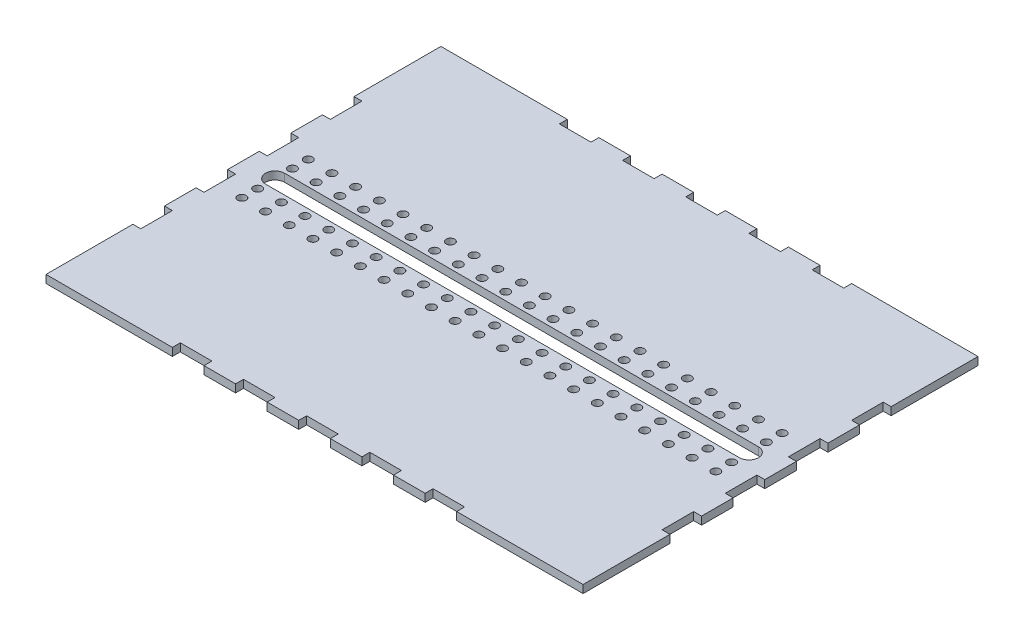
from build123d import *

# Parameters (mm, degrees)
BOSS_EXTRUDE1_DEPTH      = 1.5875
CUT_EXTRUDE1_DEPTH       = 152.481733807
SKETCH3_R                = 1.7018
CUT_EXTRUDE2_DEPTH       = 152.481733807
LPATTERN1_COUNT          = 21
LPATTERN1_PITCH          = 9.525
MIRROR1_COPY_1_SKETCH_R  = 1.7018
MIRROR1_COPY_1_DEPTH     = 152.481733807
MIRROR1_COPY_2_SKETCH_R  = 1.7018
MIRROR1_COPY_2_DEPTH     = 152.481733807
MIRROR1_COPY_3_SKETCH_R  = 1.7018
MIRROR1_COPY_3_DEPTH     = 152.481733807
MIRROR1_COPY_4_SKETCH_R  = 1.7018
MIRROR1_COPY_4_DEPTH     = 152.481733807
MIRROR1_COPY_5_SKETCH_R  = 1.7018
MIRROR1_COPY_5_DEPTH     = 152.481733807
MIRROR1_COPY_6_SKETCH_R  = 1.7018
MIRROR1_COPY_6_DEPTH     = 152.481733807
MIRROR1_COPY_7_SKETCH_R  = 1.7018
MIRROR1_COPY_7_DEPTH     = 152.481733807
MIRROR1_COPY_8_SKETCH_R  = 1.7018
MIRROR1_COPY_8_DEPTH     = 152.481733807
MIRROR1_COPY_9_SKETCH_R  = 1.7018
MIRROR1_COPY_9_DEPTH     = 152.481733807
MIRROR1_COPY_10_SKETCH_R = 1.7018
MIRROR1_COPY_10_DEPTH    = 152.481733807
MIRROR1_COPY_11_SKETCH_R = 1.7018
MIRROR1_COPY_11_DEPTH    = 152.481733807
MIRROR1_COPY_12_SKETCH_R = 1.7018
MIRROR1_COPY_12_DEPTH    = 152.481733807
MIRROR1_COPY_13_SKETCH_R = 1.7018
MIRROR1_COPY_13_DEPTH    = 152.481733807
MIRROR1_COPY_14_SKETCH_R = 1.7018
MIRROR1_COPY_14_DEPTH    = 152.481733807
MIRROR1_COPY_15_SKETCH_R = 1.7018
MIRROR1_COPY_15_DEPTH    = 152.481733807
MIRROR1_COPY_16_SKETCH_R = 1.7018
MIRROR1_COPY_16_DEPTH    = 152.481733807
MIRROR1_COPY_17_SKETCH_R = 1.7018
MIRROR1_COPY_17_DEPTH    = 152.481733807
MIRROR1_COPY_18_SKETCH_R = 1.7018
MIRROR1_COPY_18_DEPTH    = 152.481733807
MIRROR1_COPY_19_SKETCH_R = 1.7018
MIRROR1_COPY_19_DEPTH    = 152.481733807
MIRROR1_COPY_20_SKETCH_R = 1.7018
MIRROR1_COPY_20_DEPTH    = 152.481733807
MIRROR1_COPY_21_SKETCH_R = 1.7018
MIRROR1_COPY_21_DEPTH    = 152.481733807


with BuildPart() as part:
    # Sketch1 → Boss-Extrude1 (new, symmetric)
    with BuildSketch(Plane(origin=(0, 0, 0), x_dir=(1, 0, 0), z_dir=(0, 1, 0))):
        Polygon((-122.014602546, 89.716619519), (-71.214602546, 89.716619519), (-71.214602546, 86.541619519), (-58.514602546, 86.541619519), (-58.514602546, 89.716619519), (-45.814602546, 89.716619519), (-45.814602546, 86.541619519), (-33.114602546, 86.541619519), (-33.114602546, 89.716619519), (-20.414602546, 89.716619519), (-20.414602546, 86.541619519), (-7.714602546, 86.541619519), (-7.714602546, 89.716619519), (4.985397454, 89.716619519), (4.985397454, 86.541619519), (17.685397454, 86.541619519), (17.685397454, 89.716619519), (30.385397454, 89.716619519), (30.385397454, 86.541619519), (43.085397454, 86.541619519), (43.085397454, 89.716619519), (93.885397454, 89.716619519), (93.885397454, 54.791619519), (90.710397454, 54.791619519), (90.710397454, 42.091619519), (93.885397454, 42.091619519), (93.885397454, 29.391619519), (90.710397454, 29.391619519), (90.710397454, 16.691619519), (93.885397454, 16.691619519), (93.885397454, 3.991619519), (90.710397454, 3.991619519), (90.710397454, -8.708380481), (93.885397454, -8.708380481), (93.885397454, -21.408380481), (90.710397454, -21.408380481), (90.710397454, -34.108380481), (93.885397454, -34.108380481), (93.885397454, -69.033380481), (43.085397454, -69.033380481), (43.085397454, -65.858380481), (30.385397454, -65.858380481), (30.385397454, -69.033380481), (17.685397454, -69.033380481), (17.685397454, -65.858380481), (4.985397454, -65.858380481), (4.985397454, -69.033380481), (-7.714602546, -69.033380481), (-7.714602546, -65.858380481), (-20.414602546, -65.858380481), (-20.414602546, -69.033380481), (-33.114602546, -69.033380481), (-33.114602546, -65.858380481), (-45.814602546, -65.858380481), (-45.814602546, -69.033380481), (-58.514602546, -69.033380481), (-58.514602546, -65.858380481), (-71.214602546, -65.858380481), (-71.214602546, -69.033380481), (-122.014602546, -69.033380481), (-122.014602546, -34.108380481), (-118.839602546, -34.108380481), (-118.839602546, -21.408380481), (-122.014602546, -21.408380481), (-122.014602546, -8.708380481), (-118.839602546, -8.708380481), (-118.839602546, 3.991619519), (-122.014602546, 3.991619519), (-122.014602546, 16.691619519), (-118.839602546, 16.691619519), (-118.839602546, 29.391619519), (-122.014602546, 29.391619519), (-122.014602546, 42.091619519), (-118.839602546, 42.091619519), (-118.839602546, 54.791619519), (-122.014602546, 54.791619519), align=None)
    extrude(amount=BOSS_EXTRUDE1_DEPTH, both=True)

    # Sketch2 → Cut-Extrude1 (cut, through all)
    with BuildSketch(Plane(origin=(0, 1.5875, 0), x_dir=(1, 0, 0), z_dir=(0, 1, 0))):
        with BuildLine():
            Line((81.185397454, 6.531619519), (-109.314602546, 6.531619519))
            ThreePointArc((-109.314602546, 6.531619519), (-113.124602546, 10.341619519), (-109.314602546, 14.151619519))
            Line((-109.314602546, 14.151619519), (81.185397454, 14.151619519))
            ThreePointArc((81.185397454, 14.151619519), (84.995397454, 10.341619519), (81.185397454, 6.531619519))
        make_face()
    extrude(amount=-CUT_EXTRUDE1_DEPTH, mode=Mode.SUBTRACT)

    # Sketch3 → Cut-Extrude2 (cut, through all)
    with BuildSketch(Plane(origin=(0, 1.5875, 0), x_dir=(1, 0, 0), z_dir=(0, 1, 0))):
        with Locations((-109.314602546, 23.676619519)):
            Circle(SKETCH3_R)
        with Locations((-109.314602546, 17.326619519)):
            Circle(SKETCH3_R)
    cut_extrude2 = extrude(amount=-CUT_EXTRUDE2_DEPTH, mode=Mode.SUBTRACT)

    # LPattern1: Cut-Extrude2 ×21
    with Locations(*[(i * LPATTERN1_PITCH, 0, 0) for i in range(1, LPATTERN1_COUNT)]):
        add(cut_extrude2, mode=Mode.SUBTRACT)

    # Mirror1 copy 1 sketch → Mirror1 copy 1 (cut, through all)
    with BuildSketch(Plane(origin=(9.525, 1.5875, -20.683239038), x_dir=(1, 0, 0), z_dir=(0, 1, 0))):
        with Locations((-109.314602546, -23.676619519)):
            Circle(MIRROR1_COPY_1_SKETCH_R)
        with Locations((-109.314602546, -17.326619519)):
            Circle(MIRROR1_COPY_1_SKETCH_R)
    extrude(amount=-MIRROR1_COPY_1_DEPTH, mode=Mode.SUBTRACT)

    # Mirror1 copy 2 sketch → Mirror1 copy 2 (cut, through all)
    with BuildSketch(Plane(origin=(19.05, 1.5875, -20.683239038), x_dir=(1, 0, 0), z_dir=(0, 1, 0))):
        with Locations((-109.314602546, -23.676619519)):
            Circle(MIRROR1_COPY_2_SKETCH_R)
        with Locations((-109.314602546, -17.326619519)):
            Circle(MIRROR1_COPY_2_SKETCH_R)
    extrude(amount=-MIRROR1_COPY_2_DEPTH, mode=Mode.SUBTRACT)

    # Mirror1 copy 3 sketch → Mirror1 copy 3 (cut, through all)
    with BuildSketch(Plane(origin=(28.575, 1.5875, -20.683239038), x_dir=(1, 0, 0), z_dir=(0, 1, 0))):
        with Locations((-109.314602546, -23.676619519)):
            Circle(MIRROR1_COPY_3_SKETCH_R)
        with Locations((-109.314602546, -17.326619519)):
            Circle(MIRROR1_COPY_3_SKETCH_R)
    extrude(amount=-MIRROR1_COPY_3_DEPTH, mode=Mode.SUBTRACT)

    # Mirror1 copy 4 sketch → Mirror1 copy 4 (cut, through all)
    with BuildSketch(Plane(origin=(38.1, 1.5875, -20.683239038), x_dir=(1, 0, 0), z_dir=(0, 1, 0))):
        with Locations((-109.314602546, -23.676619519)):
            Circle(MIRROR1_COPY_4_SKETCH_R)
        with Locations((-109.314602546, -17.326619519)):
            Circle(MIRROR1_COPY_4_SKETCH_R)
    extrude(amount=-MIRROR1_COPY_4_DEPTH, mode=Mode.SUBTRACT)

    # Mirror1 copy 5 sketch → Mirror1 copy 5 (cut, through all)
    with BuildSketch(Plane(origin=(47.625, 1.5875, -20.683239038), x_dir=(1, 0, 0), z_dir=(0, 1, 0))):
        with Locations((-109.314602546, -23.676619519)):
            Circle(MIRROR1_COPY_5_SKETCH_R)
        with Locations((-109.314602546, -17.326619519)):
            Circle(MIRROR1_COPY_5_SKETCH_R)
    extrude(amount=-MIRROR1_COPY_5_DEPTH, mode=Mode.SUBTRACT)

    # Mirror1 copy 6 sketch → Mirror1 copy 6 (cut, through all)
    with BuildSketch(Plane(origin=(57.15, 1.5875, -20.683239038), x_dir=(1, 0, 0), z_dir=(0, 1, 0))):
        with Locations((-109.314602546, -23.676619519)):
            Circle(MIRROR1_COPY_6_SKETCH_R)
        with Locations((-109.314602546, -17.326619519)):
            Circle(MIRROR1_COPY_6_SKETCH_R)
    extrude(amount=-MIRROR1_COPY_6_DEPTH, mode=Mode.SUBTRACT)

    # Mirror1 copy 7 sketch → Mirror1 copy 7 (cut, through all)
    with BuildSketch(Plane(origin=(66.675, 1.5875, -20.683239038), x_dir=(1, 0, 0), z_dir=(0, 1, 0))):
        with Locations((-109.314602546, -23.676619519)):
            Circle(MIRROR1_COPY_7_SKETCH_R)
        with Locations((-109.314602546, -17.326619519)):
            Circle(MIRROR1_COPY_7_SKETCH_R)
    extrude(amount=-MIRROR1_COPY_7_DEPTH, mode=Mode.SUBTRACT)

    # Mirror1 copy 8 sketch → Mirror1 copy 8 (cut, through all)
    with BuildSketch(Plane(origin=(76.2, 1.5875, -20.683239038), x_dir=(1, 0, 0), z_dir=(0, 1, 0))):
        with Locations((-109.314602546, -23.676619519)):
            Circle(MIRROR1_COPY_8_SKETCH_R)
        with Locations((-109.314602546, -17.326619519)):
            Circle(MIRROR1_COPY_8_SKETCH_R)
    extrude(amount=-MIRROR1_COPY_8_DEPTH, mode=Mode.SUBTRACT)

    # Mirror1 copy 9 sketch → Mirror1 copy 9 (cut, through all)
    with BuildSketch(Plane(origin=(85.725, 1.5875, -20.683239038), x_dir=(1, 0, 0), z_dir=(0, 1, 0))):
        with Locations((-109.314602546, -23.676619519)):
            Circle(MIRROR1_COPY_9_SKETCH_R)
        with Locations((-109.314602546, -17.326619519)):
            Circle(MIRROR1_COPY_9_SKETCH_R)
    extrude(amount=-MIRROR1_COPY_9_DEPTH, mode=Mode.SUBTRACT)

    # Mirror1 copy 10 sketch → Mirror1 copy 10 (cut, through all)
    with BuildSketch(Plane(origin=(95.25, 1.5875, -20.683239038), x_dir=(1, 0, 0), z_dir=(0, 1, 0))):
        with Locations((-109.314602546, -23.676619519)):
            Circle(MIRROR1_COPY_10_SKETCH_R)
        with Locations((-109.314602546, -17.326619519)):
            Circle(MIRROR1_COPY_10_SKETCH_R)
    extrude(amount=-MIRROR1_COPY_10_DEPTH, mode=Mode.SUBTRACT)

    # Mirror1 copy 11 sketch → Mirror1 copy 11 (cut, through all)
    with BuildSketch(Plane(origin=(104.775, 1.5875, -20.683239038), x_dir=(1, 0, 0), z_dir=(0, 1, 0))):
        with Locations((-109.314602546, -23.676619519)):
            Circle(MIRROR1_COPY_11_SKETCH_R)
        with Locations((-109.314602546, -17.326619519)):
            Circle(MIRROR1_COPY_11_SKETCH_R)
    extrude(amount=-MIRROR1_COPY_11_DEPTH, mode=Mode.SUBTRACT)

    # Mirror1 copy 12 sketch → Mirror1 copy 12 (cut, through all)
    with BuildSketch(Plane(origin=(114.3, 1.5875, -20.683239038), x_dir=(1, 0, 0), z_dir=(0, 1, 0))):
        with Locations((-109.314602546, -23.676619519)):
            Circle(MIRROR1_COPY_12_SKETCH_R)
        with Locations((-109.314602546, -17.326619519)):
            Circle(MIRROR1_COPY_12_SKETCH_R)
    extrude(amount=-MIRROR1_COPY_12_DEPTH, mode=Mode.SUBTRACT)

    # Mirror1 copy 13 sketch → Mirror1 copy 13 (cut, through all)
    with BuildSketch(Plane(origin=(123.825, 1.5875, -20.683239038), x_dir=(1, 0, 0), z_dir=(0, 1, 0))):
        with Locations((-109.314602546, -23.676619519)):
            Circle(MIRROR1_COPY_13_SKETCH_R)
        with Locations((-109.314602546, -17.326619519)):
            Circle(MIRROR1_COPY_13_SKETCH_R)
    extrude(amount=-MIRROR1_COPY_13_DEPTH, mode=Mode.SUBTRACT)

    # Mirror1 copy 14 sketch → Mirror1 copy 14 (cut, through all)
    with BuildSketch(Plane(origin=(133.35, 1.5875, -20.683239038), x_dir=(1, 0, 0), z_dir=(0, 1, 0))):
        with Locations((-109.314602546, -23.676619519)):
            Circle(MIRROR1_COPY_14_SKETCH_R)
        with Locations((-109.314602546, -17.326619519)):
            Circle(MIRROR1_COPY_14_SKETCH_R)
    extrude(amount=-MIRROR1_COPY_14_DEPTH, mode=Mode.SUBTRACT)

    # Mirror1 copy 15 sketch → Mirror1 copy 15 (cut, through all)
    with BuildSketch(Plane(origin=(142.875, 1.5875, -20.683239038), x_dir=(1, 0, 0), z_dir=(0, 1, 0))):
        with Locations((-109.314602546, -23.676619519)):
            Circle(MIRROR1_COPY_15_SKETCH_R)
        with Locations((-109.314602546, -17.326619519)):
            Circle(MIRROR1_COPY_15_SKETCH_R)
    extrude(amount=-MIRROR1_COPY_15_DEPTH, mode=Mode.SUBTRACT)

    # Mirror1 copy 16 sketch → Mirror1 copy 16 (cut, through all)
    with BuildSketch(Plane(origin=(152.4, 1.5875, -20.683239038), x_dir=(1, 0, 0), z_dir=(0, 1, 0))):
        with Locations((-109.314602546, -23.676619519)):
            Circle(MIRROR1_COPY_16_SKETCH_R)
        with Locations((-109.314602546, -17.326619519)):
            Circle(MIRROR1_COPY_16_SKETCH_R)
    extrude(amount=-MIRROR1_COPY_16_DEPTH, mode=Mode.SUBTRACT)

    # Mirror1 copy 17 sketch → Mirror1 copy 17 (cut, through all)
    with BuildSketch(Plane(origin=(161.925, 1.5875, -20.683239038), x_dir=(1, 0, 0), z_dir=(0, 1, 0))):
        with Locations((-109.314602546, -23.676619519)):
            Circle(MIRROR1_COPY_17_SKETCH_R)
        with Locations((-109.314602546, -17.326619519)):
            Circle(MIRROR1_COPY_17_SKETCH_R)
    extrude(amount=-MIRROR1_COPY_17_DEPTH, mode=Mode.SUBTRACT)

    # Mirror1 copy 18 sketch → Mirror1 copy 18 (cut, through all)
    with BuildSketch(Plane(origin=(171.45, 1.5875, -20.683239038), x_dir=(1, 0, 0), z_dir=(0, 1, 0))):
        with Locations((-109.314602546, -23.676619519)):
            Circle(MIRROR1_COPY_18_SKETCH_R)
        with Locations((-109.314602546, -17.326619519)):
            Circle(MIRROR1_COPY_18_SKETCH_R)
    extrude(amount=-MIRROR1_COPY_18_DEPTH, mode=Mode.SUBTRACT)

    # Mirror1 copy 19 sketch → Mirror1 copy 19 (cut, through all)
    with BuildSketch(Plane(origin=(180.975, 1.5875, -20.683239038), x_dir=(1, 0, 0), z_dir=(0, 1, 0))):
        with Locations((-109.314602546, -23.676619519)):
            Circle(MIRROR1_COPY_19_SKETCH_R)
        with Locations((-109.314602546, -17.326619519)):
            Circle(MIRROR1_COPY_19_SKETCH_R)
    extrude(amount=-MIRROR1_COPY_19_DEPTH, mode=Mode.SUBTRACT)

    # Mirror1 copy 20 sketch → Mirror1 copy 20 (cut, through all)
    with BuildSketch(Plane(origin=(190.5, 1.5875, -20.683239038), x_dir=(1, 0, 0), z_dir=(0, 1, 0))):
        with Locations((-109.314602546, -23.676619519)):
            Circle(MIRROR1_COPY_20_SKETCH_R)
        with Locations((-109.314602546, -17.326619519)):
            Circle(MIRROR1_COPY_20_SKETCH_R)
    extrude(amount=-MIRROR1_COPY_20_DEPTH, mode=Mode.SUBTRACT)

    # Mirror1 copy 21 sketch → Mirror1 copy 21 (cut, through all)
    with BuildSketch(Plane(origin=(0, 1.5875, -20.683239038), x_dir=(1, 0, 0), z_dir=(0, 1, 0))):
        with Locations((-109.314602546, -23.676619519)):
            Circle(MIRROR1_COPY_21_SKETCH_R)
        with Locations((-109.314602546, -17.326619519)):
            Circle(MIRROR1_COPY_21_SKETCH_R)
    extrude(amount=-MIRROR1_COPY_21_DEPTH, mode=Mode.SUBTRACT)


solid = part.part
